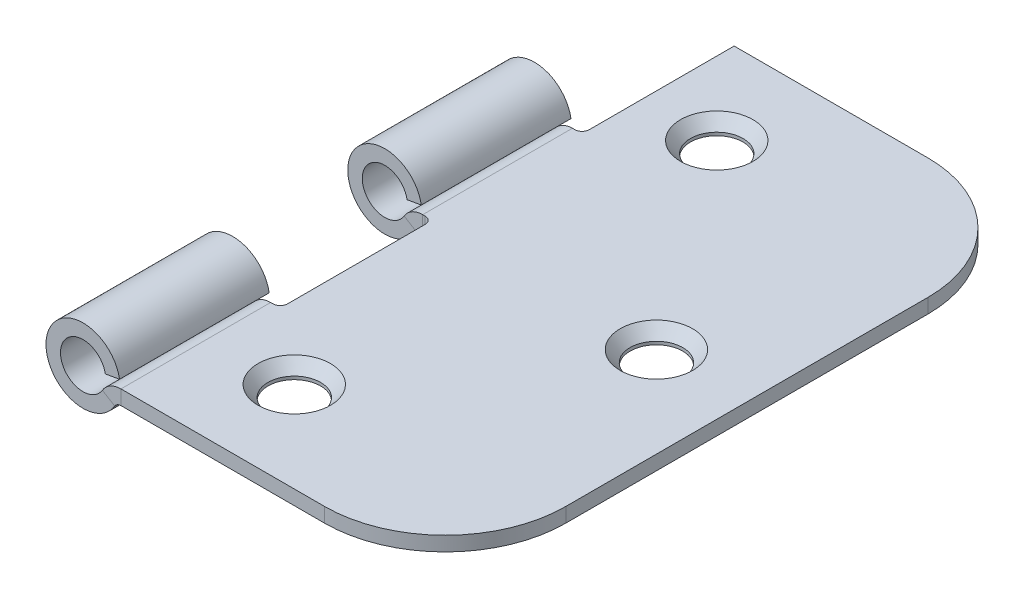
from build123d import *

# Parameters (mm, degrees)
BASICHINGE_DEPTH                              = 63.5
KNUCKLECUTS_DEPTH                             = 77.238871136
KNUCKLECUTS_DEPTH_BACK                        = 77.238871136
CSK_FOR_6_FLAT_HEAD_MACHINE_SCREW1_AT_2_COUNT = 2
CSK_FOR_6_FLAT_HEAD_MACHINE_SCREW1_AT_2_PITCH = 27.312382723
CSK_FOR_6_FLAT_HEAD_MACHINE_SCREW1_AT_3_COUNT = 2
CSK_FOR_6_FLAT_HEAD_MACHINE_SCREW1_AT_3_PITCH = 27.312382723
FLATTEN_BENDS1_OUTLINE_W                      = 19.328541328
FLATTEN_BENDS1_OUTLINE_H                      = 15.748
FLATTEN_BENDS1_DEPTH                          = 4.0259
FLATTEN_BENDS1_START                          = -3.7719
FLATTEN_BENDS1_2_OUTLINE_W                    = 19.328541328
FLATTEN_BENDS1_2_OUTLINE_H                    = 15.748
FLATTEN_BENDS1_2_DEPTH                        = 2.2479
FLATTEN_BENDS1_START_2                        = -1.524
FLATTEN_BENDS1_3_OUTLINE_W                    = 19.328541328
FLATTEN_BENDS1_3_OUTLINE_H                    = 15.748
FLATTEN_BENDS1_3_DEPTH                        = 1.524
PROCESS_BENDS1_START                          = -47.498
PROCESS_BENDS1_DEPTH                          = 47.498
PROCESS_BENDS1_2_DEPTH                        = 15.748
PROCESS_BENDS1_START_2                        = -15.748
PROCESS_BENDS1_3_DEPTH                        = 15.748
FILLET1_R                                     = 12.7


# Read off the part's stored shape, not the designer's step: Flatten-Bends1, Process-Bends1
with BuildPart() as part:
    # Sketch1 → BasicHinge (new body)
    with BuildSketch(Plane.XY):
        with BuildLine():
            Line((0, -1.524), (0, 0))
            Line((0, 0), (-34.112341563, 0))
            ThreePointArc((-34.112341563, 0), (-35.234915175, -0.294612422), (-36.068141341, -1.102512262))
            ThreePointArc((-36.068141341, -1.102512262), (-40.434453767, 0.563435127), (-35.761180067, 0.539397057))
            Line((-35.761180067, 0.539397057), (-34.260333052, 0.80403688))
            ThreePointArc((-34.260333052, 0.80403688), (-41.932498965, 0.843500449), (-34.764274822, -1.891504087))
            ThreePointArc((-34.764274822, -1.891504087), (-34.486532767, -1.622204141), (-34.112341563, -1.524))
            Line((-34.112341563, -1.524), (0, -1.524))
        make_face()
    extrude(amount=-BASICHINGE_DEPTH)

    # Sketch4 → KnuckleCuts (cut, two sides: drawn at the far end of the back side and taken through both)
    with BuildSketch(Plane(origin=(0, 0, 0), x_dir=(-1, 0, 0), z_dir=(0, 1, 0)).offset(-KNUCKLECUTS_DEPTH_BACK)):
        with BuildLine():
            Line((41.9989, -63.5), (33.096341563, -63.5))
            Line((33.096341563, -63.5), (33.096341563, -48.26))
            ThreePointArc((33.096341563, -48.26), (33.319526196, -47.721184633), (33.858341563, -47.498))
            Line((33.858341563, -47.498), (41.9989, -47.498))
            Line((41.9989, -47.498), (41.9989, -63.5))
        make_face()
        with BuildLine():
            Line((41.9989, -31.75), (33.858341563, -31.75))
            ThreePointArc((33.858341563, -31.75), (33.319526196, -31.526815367), (33.096341563, -30.988))
            Line((33.096341563, -30.988), (33.096341563, -16.51))
            ThreePointArc((33.096341563, -16.51), (33.319526196, -15.971184633), (33.858341563, -15.748))
            Line((33.858341563, -15.748), (41.9989, -15.748))
            Line((41.9989, -15.748), (41.9989, -31.75))
        make_face()
    extrude(amount=KNUCKLECUTS_DEPTH + KNUCKLECUTS_DEPTH_BACK, mode=Mode.SUBTRACT)

    # Sketch5 → CSK for #6 Flat Head Machine Screw1 (revolve, cut)
    with BuildSketch(Plane(origin=(-9.525, 0, -31.75), x_dir=(0, 0, 1), z_dir=(1, 0, 0))):
        Polygon((0, 0), (0, 1.524), (2.7686, 1.524), (2.7686, 1.197993659), (3.81, 0), align=None)
    csk_for_6_flat_head_machine_screw1 = revolve(axis=Axis((-9.525, 6.35, -31.75), (0, -1, 0)), mode=Mode.SUBTRACT)

    # CSK for #6 Flat Head Machine Screw1 at 2: CSK for #6 Flat Head Machine Screw1 ×2
    with Locations(*[Vector(-0.5812381937190965, 0, 0.813733471206735) * (i * CSK_FOR_6_FLAT_HEAD_MACHINE_SCREW1_AT_2_PITCH) for i in range(1, CSK_FOR_6_FLAT_HEAD_MACHINE_SCREW1_AT_2_COUNT)]):
        add(csk_for_6_flat_head_machine_screw1, mode=Mode.SUBTRACT)

    # CSK for #6 Flat Head Machine Screw1 at 3: CSK for #6 Flat Head Machine Screw1 ×2
    with Locations(*[Vector(-0.5812381937190965, 0, -0.813733471206735) * (i * CSK_FOR_6_FLAT_HEAD_MACHINE_SCREW1_AT_3_PITCH) for i in range(1, CSK_FOR_6_FLAT_HEAD_MACHINE_SCREW1_AT_3_COUNT)]):
        add(csk_for_6_flat_head_machine_screw1, mode=Mode.SUBTRACT)

    # Flatten-Bends1 outline → Flatten-Bends1 (cut)
    with BuildSketch(Plane(origin=(0, 0, 0), x_dir=(1, 0, 0), z_dir=(0, 1, 0))):
        with Locations((-42.664270664, 39.624)):
            Rectangle(FLATTEN_BENDS1_OUTLINE_W, FLATTEN_BENDS1_OUTLINE_H)
        with Locations((-42.664270664, 7.874)):
            Rectangle(FLATTEN_BENDS1_OUTLINE_W, FLATTEN_BENDS1_OUTLINE_H)
    extrude(amount=FLATTEN_BENDS1_DEPTH, mode=Mode.SUBTRACT)

    # Flatten-Bends1 2 outline → Flatten-Bends1 2 (cut)
    with BuildSketch(Plane(origin=(0, 0, 0), x_dir=(1, 0, 0), z_dir=(0, 1, 0)).offset(FLATTEN_BENDS1_START)):
        with Locations((-42.664270664, 39.624)):
            Rectangle(FLATTEN_BENDS1_2_OUTLINE_W, FLATTEN_BENDS1_2_OUTLINE_H)
        with Locations((-42.664270664, 7.874)):
            Rectangle(FLATTEN_BENDS1_2_OUTLINE_W, FLATTEN_BENDS1_2_OUTLINE_H)
    extrude(amount=FLATTEN_BENDS1_2_DEPTH, mode=Mode.SUBTRACT)

    # Flatten-Bends1 3 outline → Flatten-Bends1 3 (add)
    with BuildSketch(Plane(origin=(0, 0, 0), x_dir=(1, 0, 0), z_dir=(0, 1, 0)).offset(FLATTEN_BENDS1_START_2)):
        with Locations((-42.664270664, 39.624)):
            Rectangle(FLATTEN_BENDS1_3_OUTLINE_W, FLATTEN_BENDS1_3_OUTLINE_H)
        with Locations((-42.664270664, 7.874)):
            Rectangle(FLATTEN_BENDS1_3_OUTLINE_W, FLATTEN_BENDS1_3_OUTLINE_H)
    extrude(amount=FLATTEN_BENDS1_3_DEPTH)

    # Process-Bends1 outline → Process-Bends1 (cut)
    with BuildSketch(Plane.XY.offset(PROCESS_BENDS1_START)):
        with BuildLine():
            ThreePointArc((-36.392853547, -1.524), (-36.218656654, -1.322378221), (-36.068141341, -1.102512262))
            ThreePointArc((-36.068141341, -1.102512262), (-35.234915175, -0.294612422), (-34.112341563, 0))
            Line((-34.112341563, 0), (-40.471501847, 0))
            ThreePointArc((-40.471501847, 0), (-40.277036286, -0.822032677), (-39.807146453, -1.524))
            Line((-39.807146453, -1.524), (-36.392853547, -1.524))
        make_face()
        with BuildLine():
            Line((-52.328541328, -1.524), (-41.632084401, -1.524))
            ThreePointArc((-41.632084401, -1.524), (-41.891812256, -0.780513652), (-41.996831047, 0))
            Line((-41.996831047, 0), (-52.328541328, 0))
            Line((-52.328541328, 0), (-52.328541328, -1.524))
        make_face()
    extrude(amount=PROCESS_BENDS1_DEPTH, mode=Mode.SUBTRACT)

    # Process-Bends1 2 outline → Process-Bends1 2 (add)
    with BuildSketch(Plane.XY.offset(PROCESS_BENDS1_START)):
        with BuildLine():
            Line((-34.112341563, -1.524), (-36.392853547, -1.524))
            ThreePointArc((-36.392853547, -1.524), (-38.1, -2.247900001), (-39.807146453, -1.524))
            Line((-39.807146453, -1.524), (-41.632084401, -1.524))
            ThreePointArc((-41.632084401, -1.524), (-38.308336386, -3.76632983), (-34.764274822, -1.891504087))
            ThreePointArc((-34.764274822, -1.891504087), (-34.486532767, -1.622204141), (-34.112341563, -1.524))
        make_face()
        with BuildLine():
            Line((-41.996831047, 0), (-40.471501847, 0))
            ThreePointArc((-40.471501847, 0), (-38.370193122, 2.486479961), (-35.761180067, 0.539397057))
            Line((-35.761180067, 0.539397057), (-34.260333052, 0.80403688))
            ThreePointArc((-34.260333052, 0.80403688), (-38.503033199, 4.00501308), (-41.996831047, 0))
        make_face()
    extrude(amount=PROCESS_BENDS1_2_DEPTH)

    # Process-Bends1 3 outline → Process-Bends1 3 (add)
    with BuildSketch(Plane.XY.offset(PROCESS_BENDS1_START_2)):
        with BuildLine():
            Line((-34.112341563, -1.524), (-36.392853547, -1.524))
            ThreePointArc((-36.392853547, -1.524), (-38.1, -2.247900001), (-39.807146453, -1.524))
            Line((-39.807146453, -1.524), (-41.632084401, -1.524))
            ThreePointArc((-41.632084401, -1.524), (-38.308336386, -3.76632983), (-34.764274822, -1.891504087))
            ThreePointArc((-34.764274822, -1.891504087), (-34.486532767, -1.622204141), (-34.112341563, -1.524))
        make_face()
        with BuildLine():
            Line((-41.996831047, 0), (-40.471501847, 0))
            ThreePointArc((-40.471501847, 0), (-38.370193122, 2.486479961), (-35.761180067, 0.539397057))
            Line((-35.761180067, 0.539397057), (-34.260333052, 0.80403688))
            ThreePointArc((-34.260333052, 0.80403688), (-38.503033199, 4.00501308), (-41.996831047, 0))
        make_face()
    extrude(amount=PROCESS_BENDS1_3_DEPTH)

    # Fillet1
    fillet1_edges = [part.edges().sort_by_distance(p)[0] for p in [
        (0, -0.762, -63.5),
        (0, -0.762, 0),
    ]]
    fillet(fillet1_edges, radius=FILLET1_R)


solid = part.part
